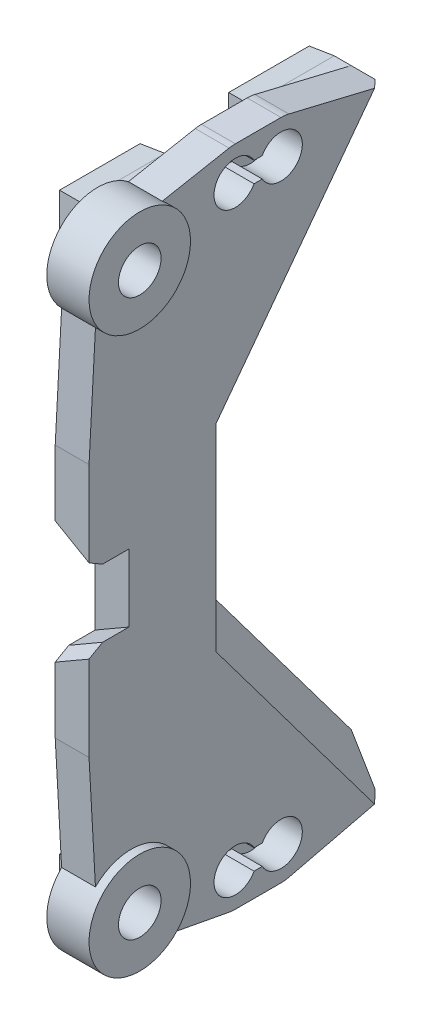
from build123d import *
from OCP.BRepFilletAPI import BRepFilletAPI_MakeChamfer

# Parameters (mm, degrees)
DOWELSUPPORT_DEPTH       = 1.905
DOWELSUPPORT_DEPTH_BACK  = 1.27
SKETCH3_R                = 3.81
SKETCH5_W                = 9.525
SKETCH5_H                = 19.05
SLIDERDOWELSUPPORT_DEPTH = 1.27
STRINGDOWELSUPPORT_DEPTH = 1.27
SKETCH9_W                = 6.35
SKETCH9_H                = 3
TABSUPPORT_DEPTH         = 1.27
INTERSUPPORT_DEPTH       = 1.27
DOWELHOLES_DEPTH         = 30.584731096
DOWELHOLES_DEPTH_BACK    = 30.584731096
SKETCH11_R               = 1.600000102
BOSS_EXTRUDE1_START      = -1.27
SKETCH11_2_R             = 1.600000102
BOSS_EXTRUDE1_DEPTH      = 0.254
SKETCH14_W               = 6.35
SKETCH14_H               = 3
TABBASE_DEPTH            = 1.27
SKETCH15_W               = 6.35
SKETCH15_H               = 3
TABDRAFT_DEPTH           = 1.73
TABDRAFT_DRAFT           = 5
TABDRAFT_PROFILE_2_DEPTH = 1.73
TABDRAFT_PROFILE_2_DRAFT = 5
CHAMFER1_SIZE            = 2.54
CUT_EXTRUDE1_DEPTH       = 3
CHAMFER2_SIZE            = 0.508
CHAMFER2_SIZE2           = 1.016


with BuildPart() as part:
    # Sketch3 → DowelSupport (new, two sides: drawn at the far end of the back side and taken through both)
    with BuildSketch(Plane(origin=(0, 0, 0), x_dir=(0, 0, -1), z_dir=(1, 0, 0)).offset(-DOWELSUPPORT_DEPTH_BACK)):
        with Locations((-3.175, 20.88375)):
            Circle(SKETCH3_R)
    extrude(amount=DOWELSUPPORT_DEPTH + DOWELSUPPORT_DEPTH_BACK)



with BuildPart() as body_2:
    # Sketch5 → SliderDowelSupport (new, symmetric)
    with BuildSketch(Plane(origin=(0, 0, 0), x_dir=(0, 0, -1), z_dir=(1, 0, 0))):
        with Locations((-1.5875, 0)):
            Rectangle(SKETCH5_W, SKETCH5_H)
    extrude(amount=SLIDERDOWELSUPPORT_DEPTH, both=True)


with BuildPart() as body_3:
    # Sketch8 → StringDowelSupport (new, symmetric)
    with BuildSketch(Plane(origin=(0, 0, 0), x_dir=(0, 0, -1), z_dir=(1, 0, 0))):
        with BuildLine():
            Line((4.6355, 24.892), (8.0645, 24.892))
            ThreePointArc((8.0645, 24.892), (10.6045, 22.352), (8.0645, 19.812))
            Line((8.0645, 19.812), (4.6355, 19.812))
            ThreePointArc((4.6355, 19.812), (2.0955, 22.352), (4.6355, 24.892))
        make_face()
    extrude(amount=STRINGDOWELSUPPORT_DEPTH, both=True)


with BuildPart() as part_1:
    add(part.part)

    add(body_3.part)  # TabSupport merges body 3
    # Sketch9 → TabSupport (add, symmetric)
    with BuildSketch(Plane(origin=(0, 0, 0), x_dir=(0, 0, -1), z_dir=(1, 0, 0))):
        with Locations((0, 21.59)):
            Rectangle(SKETCH9_W, SKETCH9_H)
        with Locations((12.7, 21.59)):
            Rectangle(SKETCH9_W, SKETCH9_H)
    extrude(amount=TABSUPPORT_DEPTH, both=True)


    add(body_2.part)  # InterSupport merges body 2
    # Sketch10 → InterSupport (add, symmetric)
    with BuildSketch(Plane(origin=(0, 0, 0), x_dir=(0, 0, -1), z_dir=(1, 0, 0))):
        Polygon((-6.35, 9.525), (-5.711088789, 21.024652996), (-3.644260291, 23.380026182), (4.166239709, 24.848276182), (8.657140431, 24.821894192), (15.875, 23.09), (15.875, 20.09), (3.175, 3.175), (3.175, 9.525), align=None)
    extrude(amount=INTERSUPPORT_DEPTH, both=True)

    # Sketch11 → DowelHoles (cut, two sides: drawn at the far end of the back side and taken through both)
    with BuildSketch(Plane(origin=(0, 0, 0), x_dir=(0, 0, -1), z_dir=(1, 0, 0)).offset(-DOWELHOLES_DEPTH_BACK)):
        with Locations((-3.175, 20.88375)):
            Circle(SKETCH11_R)
        with BuildLine():
            Line((6.04239599, 21.59), (6.65760401, 21.59))
            ThreePointArc((6.65760401, 21.59), (9.664500102, 22.352), (6.65760401, 23.114))
            Line((6.65760401, 23.114), (6.04239599, 23.114))
            ThreePointArc((6.04239599, 23.114), (3.035499898, 22.352), (6.04239599, 21.59))
        make_face()
    extrude(amount=DOWELHOLES_DEPTH + DOWELHOLES_DEPTH_BACK, mode=Mode.SUBTRACT)

    # Sketch11<2> → Boss-Extrude1 (add)
    with BuildSketch(Plane(origin=(0, 0, 0), x_dir=(0, 0, -1), z_dir=(1, 0, 0)).offset(BOSS_EXTRUDE1_START)):
        with BuildLine():
            Line((6.04239599, 21.59), (6.65760401, 21.59))
            ThreePointArc((6.65760401, 21.59), (9.664500102, 22.352), (6.65760401, 23.114))
            Line((6.65760401, 23.114), (6.04239599, 23.114))
            ThreePointArc((6.04239599, 23.114), (3.035499898, 22.352), (6.04239599, 21.59))
        make_face()
        with Locations((-3.175, 20.88375)):
            Circle(SKETCH11_2_R)
    extrude(amount=BOSS_EXTRUDE1_DEPTH)

    # Sketch14 → TabBase (add)
    with BuildSketch(Plane.ZY.offset(1.27)):
        with Locations((-12.7, 21.59)):
            Rectangle(SKETCH14_W, SKETCH14_H)
        with Locations((0, 21.59)):
            Rectangle(SKETCH14_W, SKETCH14_H)
    extrude(amount=TABBASE_DEPTH)


with BuildPart() as tabdraft_tool:
    # Sketch15 → TabDraft (with draft: the straight prism first)
    with BuildSketch(Plane.ZY.offset(2.54)):
        with Locations((0, 21.59)):
            Rectangle(SKETCH15_W, SKETCH15_H)
    extrude(amount=TABDRAFT_DEPTH)
    # TabDraft: the draft: its side faces are tilted about the plane it starts from
    tabdraft_sides = [tabdraft_tool.faces().sort_by_distance(p)[0] for p in [
        (-3.405, 21.59, -3.175),
        (-3.405, 20.09, 0),
        (-3.405, 21.59, 3.175),
        (-3.405, 23.09, 0),
    ]]
    draft(tabdraft_sides, Plane.ZY.offset(2.54), TABDRAFT_DRAFT)


with BuildPart() as part_2:
    add(part_1.part)

    # TabDraft: add tabdraft_tool
    add(tabdraft_tool.part)


with BuildPart() as tabdraft_profile_2_tool:
    # Sketch15 → TabDraft profile 2 (with draft: the straight prism first)
    with BuildSketch(Plane.ZY.offset(2.54)):
        with Locations((-12.7, 21.59)):
            Rectangle(SKETCH15_W, SKETCH15_H)
    extrude(amount=TABDRAFT_PROFILE_2_DEPTH)
    # TabDraft profile 2: the draft: its side faces are tilted about the plane it starts from
    tabdraft_profile_2_sides = [tabdraft_profile_2_tool.faces().sort_by_distance(p)[0] for p in [
        (-3.405, 21.59, -15.875),
        (-3.405, 20.09, -12.7),
        (-3.405, 21.59, -9.525),
        (-3.405, 23.09, -12.7),
    ]]
    draft(tabdraft_profile_2_sides, Plane.ZY.offset(2.54), TABDRAFT_PROFILE_2_DRAFT)


with BuildPart() as part_3:
    add(part_2.part)

    # TabDraft profile 2: add tabdraft_profile_2_tool
    add(tabdraft_profile_2_tool.part)

    # Chamfer1
    chamfer1_edges = [part_3.edges().sort_by_distance(p)[0] for p in [
        (1.27, 11.6325, -9.525),
    ]]
    chamfer(chamfer1_edges, length=CHAMFER1_SIZE - 0.0001)  # a hair under: the kernel refuses the full size

    # Mirror1: part across plane


with BuildPart() as part_4:
    add(part_3.part)
    add(part_3.part.mirror(Plane.ZX))

    # Sketch16 → Cut-Extrude1 (cut)
    with BuildSketch(Plane.XY.offset(6.35)):
        Polygon((-1.27, -4.006469684), (1.27, -2.54), (1.27, 2.54), (-1.27, 4.006469684), align=None)
    extrude(amount=-CUT_EXTRUDE1_DEPTH, mode=Mode.SUBTRACT)

    # Chamfer2: one chamfer whose edges measure the first distance from different faces: ONE call of the kernel's chamfer builder (chamfer() names one face for all edges)
    chamfer2_edges_1 = [part_4.edges().sort_by_distance(p)[0] for p in [
        (0, -3.273234842, 6.35),
    ]]
    chamfer2_side_1 = [part_4.faces().sort_by_distance(p)[0] for p in [
        (0.049650417, -6.38478458, 6.35),
    ]]
    chamfer2_edges_2 = [part_4.edges().sort_by_distance(p)[0] for p in [
        (0, 3.273234842, 6.35),
    ]]
    chamfer2_side_2 = [part_4.faces().sort_by_distance(p)[0] for p in [
        (0.049650417, 6.38478458, 6.35),
    ]]
    chamfer2 = BRepFilletAPI_MakeChamfer(part_4.part.solid().wrapped)
    for e in chamfer2_edges_1:
        chamfer2.Add(CHAMFER2_SIZE, CHAMFER2_SIZE2, e.wrapped, chamfer2_side_1[0].wrapped)  # the first distance lies on this face
    for e in chamfer2_edges_2:
        chamfer2.Add(CHAMFER2_SIZE, CHAMFER2_SIZE2, e.wrapped, chamfer2_side_2[0].wrapped)  # the first distance lies on this face
    add(Compound.cast(chamfer2.Shape()), mode=Mode.REPLACE)


solid = part_4.part
